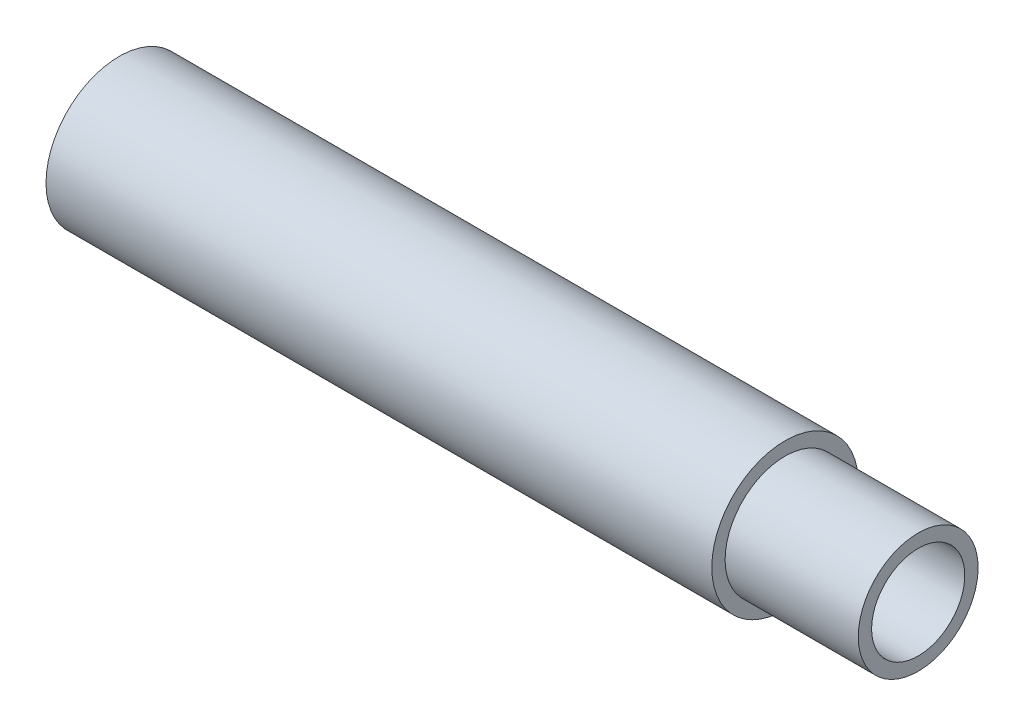
from build123d import *


with BuildPart() as part:
    # Sketch1 → Revolve1 (revolve)
    with BuildSketch(Plane(origin=(0, 0, 0), x_dir=(1, 0, 0), z_dir=(0, 1, 0))):
        Polygon((-13.737387097, 0), (0, -5), (50, -5), (50, 0), (0, 0), (0, 5), (-250, 5), (-250, 0), align=None)
    revolve(axis=Axis((-250, 0, 22.5), (1, 0, 0)))


solid = part.part
